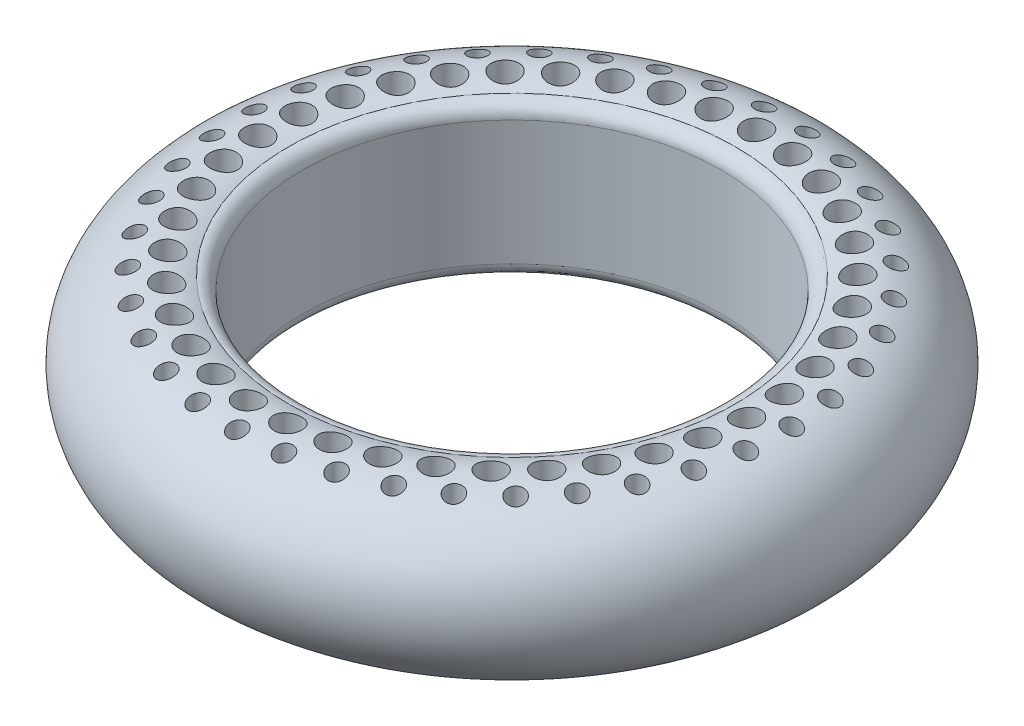
from build123d import *
from build123d.topology import SkipClean

# Parameters (mm, degrees)
SKETCH2_R          = 3
SKETCH2_R_2        = 2
CUT_EXTRUDE1_DEPTH = 105.398767698
CIRPATTERN1_COUNT  = 39


with BuildPart() as part:
    # Sketch1 → Revolve1 (revolve)
    with BuildSketch(Plane.XY):
        with BuildLine():
            Line((-46.25, 13.75), (-46.25, -13.75))
            ThreePointArc((-46.25, -13.75), (-47.128679656, -15.871320344), (-49.25, -16.75))
            ThreePointArc((-49.25, -16.75), (-72.75, 0), (-49.25, 16.75))
            ThreePointArc((-49.25, 16.75), (-47.128679656, 15.871320344), (-46.25, 13.75))
        make_face()
    revolve(axis=Axis((0, 43.558063813, 0), (0, -1, 0)))

    # Sketch2 → Cut-Extrude1 (cut, symmetric)
    with SkipClean():  # the faces are left unmerged after this step: merging them gives an invalid solid
        with BuildSketch(Plane(origin=(0, 0, 0), x_dir=(1, 0, 0), z_dir=(0, 1, 0))):
            with Locations((0, 54)):
                Circle(SKETCH2_R)
            with Locations((-4.185388425, 59.853843016)):
                Circle(SKETCH2_R_2)
        cut_extrude1 = extrude(amount=CUT_EXTRUDE1_DEPTH, both=True, mode=Mode.SUBTRACT)

    # CirPattern1: Cut-Extrude1 ×39 about axis
    with SkipClean():  # the faces are left unmerged after this step: merging them gives an invalid solid
        cirpattern1_axis = Axis((0, 43.558063813, 0), (0, 1, 0))
        for i in range(1, CIRPATTERN1_COUNT):
            add(cut_extrude1.rotate(cirpattern1_axis, i * 360 / CIRPATTERN1_COUNT), mode=Mode.SUBTRACT)


solid = part.part
